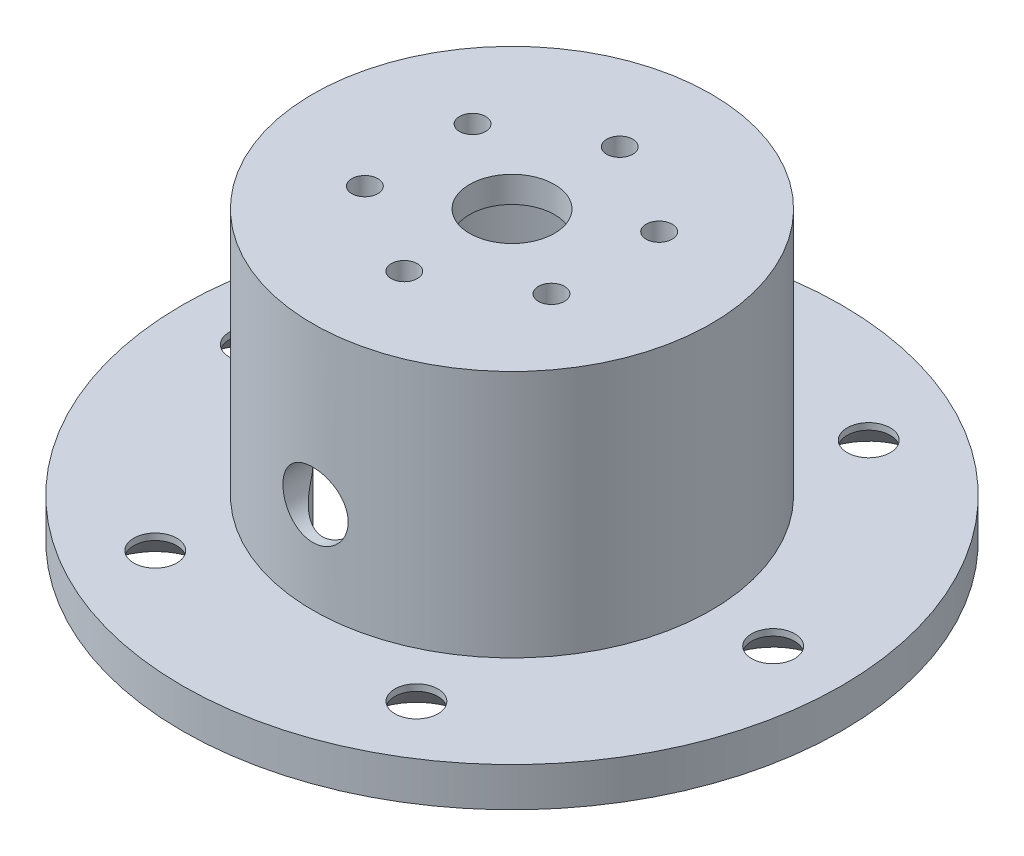
from build123d import *

# Parameters (mm, degrees)
SKETCH2_R                    = 1
SKETCH2_R_2                  = 1.65
CUT_EXTRUDE1_DEPTH           = 42.941924133
CHAMFER2_SIZE                = 2.5
CIRPATTERN1_COUNT            = 6
CHAMFER2_OF_CIRPATTERN1_SIZE = 2.5
SKETCH3_R                    = 2.5
CUT_EXTRUDE2_DEPTH           = 38.671275529
CUT_EXTRUDE3_START           = -10
CUT_EXTRUDE3_DEPTH           = 10


with BuildPart() as part:
    # Sketch1 → Revolve1 (revolve)
    with BuildSketch(Plane.XY):
        Polygon((3.25, 10), (3.25, 12), (15.25, 12), (15.25, -7), (25.25, -7), (25.25, -10), (13, -10), (13, 10), align=None)
    revolve(axis=Axis((0, -8.78125, 0), (0, 1, 0)))

    # Sketch2 → Cut-Extrude1 (cut, through all)
    with BuildSketch(Plane(origin=(0, 12, 0), x_dir=(1, 0, 0), z_dir=(0, 1, 0))):
        with Locations((0, 8.25)):
            Circle(SKETCH2_R)
        with Locations((20, 0)):
            Circle(SKETCH2_R_2)
    cut_extrude1 = extrude(amount=-CUT_EXTRUDE1_DEPTH, mode=Mode.SUBTRACT)

    # Chamfer2
    chamfer2_edges = [part.edges().sort_by_distance(p)[0] for p in [
        (18.35, -10, 0),
    ]]
    chamfer(chamfer2_edges, length=CHAMFER2_SIZE)

    # CirPattern1: Cut-Extrude1 ×6 about axis
    cirpattern1_axis = Axis((0, -8.78125, 0), (0, -1, 0))
    for i in range(1, CIRPATTERN1_COUNT):
        add(cut_extrude1.rotate(cirpattern1_axis, i * 360 / CIRPATTERN1_COUNT), mode=Mode.SUBTRACT)

    # Chamfer2 of CirPattern1
    chamfer2_of_cirpattern1_edges = [part.edges().sort_by_distance(p)[0] for p in [
        (9.175, -10, 15.891566159),
        (-9.175, -10, 15.891566159),
        (-18.35, -10, 0),
        (-9.175, -10, -15.891566159),
        (9.175, -10, -15.891566159),
    ]]
    chamfer(chamfer2_of_cirpattern1_edges, length=CHAMFER2_OF_CIRPATTERN1_SIZE)

    # Sketch3 → Cut-Extrude2 (cut, through all)
    with BuildSketch(Plane.XY):
        Circle(SKETCH3_R)
    extrude(amount=CUT_EXTRUDE2_DEPTH, mode=Mode.SUBTRACT)

    # Sketch4 → Cut-Extrude3 (cut)
    with BuildSketch(Plane.XZ.offset(10).offset(CUT_EXTRUDE3_START)):
        with BuildLine():
            ThreePointArc((2.5, 12.757350822), (0, 13), (-2.5, 12.757350822))
            ThreePointArc((-2.5, 12.757350822), (0, 14.5), (2.5, 12.757350822))
        make_face()
    extrude(amount=CUT_EXTRUDE3_DEPTH, mode=Mode.SUBTRACT)


solid = part.part
